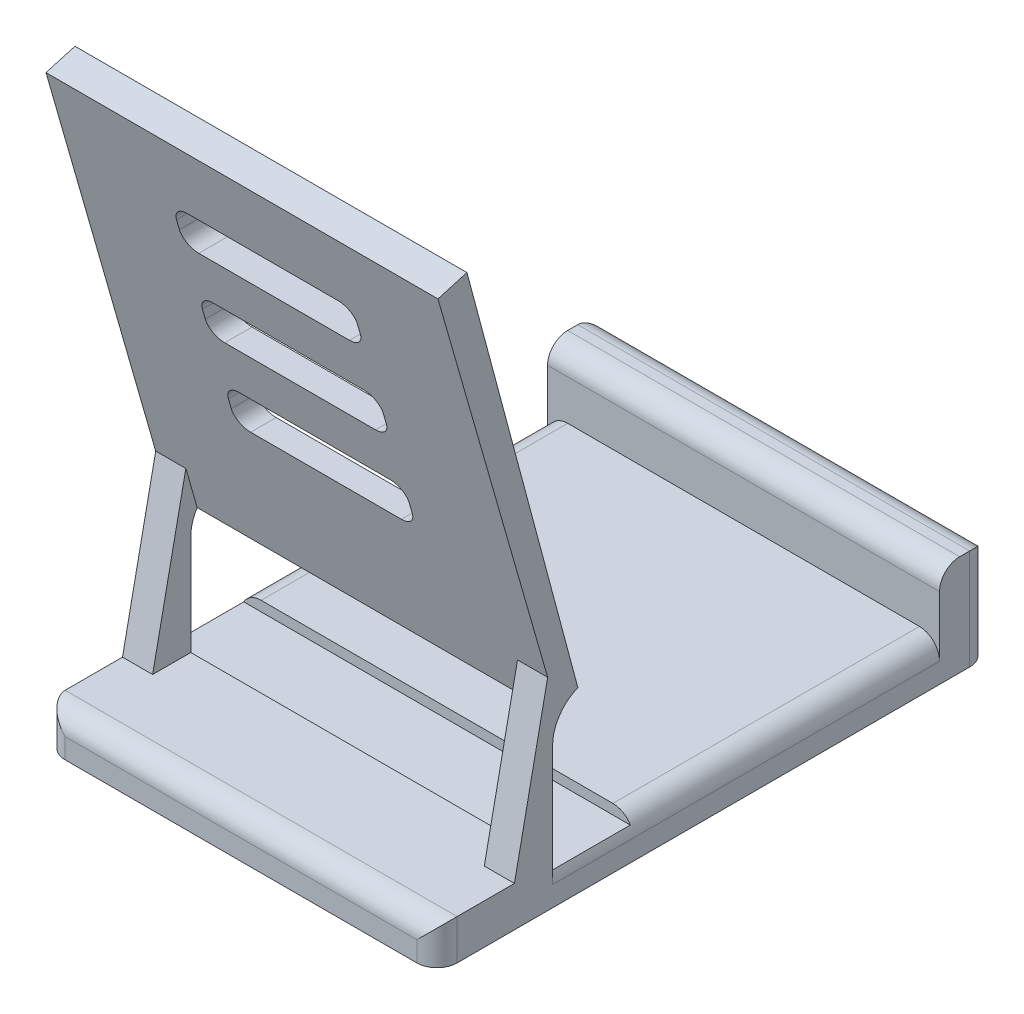
from build123d import *

# Parameters (mm, degrees)
EXTRUDE_1_DEPTH     = 78
EXTRUDE_2_DEPTH     = 78
EXTRUDE_4_DEPTH     = 6
CUT_EXTRUDE_3_DEPTH = 80
CUT_EXTRUDE_4_DEPTH = 160.514889587
CUT_EXTRUDE_5_DEPTH = 170.32217811
SKETCH_10_W         = 24
SKETCH_10_H         = 10
CUT_EXTRUDE_6_DEPTH = 1.5
FILLET_1_R          = 4
FILLET_START        = -45
FILLET_6_DEPTH      = 77
FILLET_START_2      = -39
FILLET_6_2_DEPTH    = 78


with BuildPart() as part:
    # 草图1 → 凸台-拉伸1 (new body)
    with BuildSketch(Plane(origin=(-39, 0, 0), x_dir=(0, 0, -1), z_dir=(1, 0, 0))):
        Polygon((55, 0), (-55, 0), (-55, 8), (45, 8), (45, 20), (55, 20), align=None)
    extrude(amount=EXTRUDE_1_DEPTH)

    # 草图2 → 凸台-拉伸2 (add)
    with BuildSketch(Plane(origin=(-39, 0, 0), x_dir=(0, 0, -1), z_dir=(1, 0, 0))):
        Polygon((-17.5, 0), (-49.042, 118), (-54.81, 116.346), (-21.45, 0), align=None)
    extrude(amount=EXTRUDE_2_DEPTH)

    # 草图4 → 凸台-拉伸4 (add)
    with BuildSketch(Plane(origin=(33, 0, 0), x_dir=(0, 0, -1), z_dir=(1, 0, 0))):
        Polygon((-20, 6), (-40, 6), (-32, 45), align=None)
    extrude_4 = extrude(amount=EXTRUDE_4_DEPTH)

    # 镜向1: 凸台-拉伸4 across plane
    add(extrude_4.mirror(Plane(origin=(0, 0, 0), x_dir=(0, 0, 1), z_dir=(1, 0, 0))))

    # 草图7 → 切除-拉伸3 (cut)
    with BuildSketch(Plane(origin=(-40, 0, 0), x_dir=(0, 0, -1), z_dir=(1, 0, 0))):
        with BuildLine():
            Line((-16, 6), (-16, 28))
            ThreePointArc((-16, 28), (-24, 36), (-32, 28))
            Line((-32, 28), (-32, 6))
            Line((-32, 6), (-16, 6))
        make_face()
    extrude(amount=CUT_EXTRUDE_3_DEPTH, mode=Mode.SUBTRACT)

    # 草图8 → 切除-拉伸4 (cut, through all)
    with BuildSketch(Plane.XY.offset(45)):
        with BuildLine():
            Line((-15, 58), (15, 58))
            ThreePointArc((15, 58), (17.121320344, 58.878679656), (18, 61))
            Line((18, 61), (18, 63))
            ThreePointArc((18, 63), (17.121320344, 65.121320344), (15, 66))
            Line((15, 66), (-15, 66))
            ThreePointArc((-15, 66), (-17.121320344, 65.121320344), (-18, 63))
            Line((-18, 63), (-18, 61))
            ThreePointArc((-18, 61), (-17.121320344, 58.878679656), (-15, 58))
        make_face()
        with BuildLine():
            Line((-15, 76), (15, 76))
            ThreePointArc((15, 76), (17.121320344, 76.878679656), (18, 79))
            Line((18, 79), (18, 81))
            ThreePointArc((18, 81), (17.121320344, 83.121320344), (15, 84))
            Line((15, 84), (-15, 84))
            ThreePointArc((-15, 84), (-17.121320344, 83.121320344), (-18, 81))
            Line((-18, 81), (-18, 79))
            ThreePointArc((-18, 79), (-17.121320344, 76.878679656), (-15, 76))
        make_face()
        with BuildLine():
            Line((-15, 94), (15, 94))
            ThreePointArc((15, 94), (17.121320344, 94.878679656), (18, 97))
            Line((18, 97), (18, 99))
            ThreePointArc((18, 99), (17.121320344, 101.121320344), (15, 102))
            Line((15, 102), (-15, 102))
            ThreePointArc((-15, 102), (-17.121320344, 101.121320344), (-18, 99))
            Line((-18, 99), (-18, 97))
            ThreePointArc((-18, 97), (-17.121320344, 94.878679656), (-15, 94))
        make_face()
    extrude(amount=-CUT_EXTRUDE_4_DEPTH, mode=Mode.SUBTRACT)

    # 草图9 → 切除-拉伸5 (cut, through all)
    with BuildSketch(Plane.XY.offset(60)):
        with BuildLine():
            Line((-15, 58), (15, 58))
            ThreePointArc((15, 58), (17.121320344, 58.878679656), (18, 61))
            Line((18, 61), (18, 63))
            ThreePointArc((18, 63), (17.121320344, 65.121320344), (15, 66))
            Line((15, 66), (-15, 66))
            ThreePointArc((-15, 66), (-17.121320344, 65.121320344), (-18, 63))
            Line((-18, 63), (-18, 61))
            ThreePointArc((-18, 61), (-17.121320344, 58.878679656), (-15, 58))
        make_face()
        with BuildLine():
            Line((-15, 76), (15, 76))
            ThreePointArc((15, 76), (17.121320344, 76.878679656), (18, 79))
            Line((18, 79), (18, 81))
            ThreePointArc((18, 81), (17.121320344, 83.121320344), (15, 84))
            Line((15, 84), (-15, 84))
            ThreePointArc((-15, 84), (-17.121320344, 83.121320344), (-18, 81))
            Line((-18, 81), (-18, 79))
            ThreePointArc((-18, 79), (-17.121320344, 76.878679656), (-15, 76))
        make_face()
        with BuildLine():
            Line((-15, 94), (15, 94))
            ThreePointArc((15, 94), (17.121320344, 94.878679656), (18, 97))
            Line((18, 97), (18, 99))
            ThreePointArc((18, 99), (17.121320344, 101.121320344), (15, 102))
            Line((15, 102), (-15, 102))
            ThreePointArc((-15, 102), (-17.121320344, 101.121320344), (-18, 99))
            Line((-18, 99), (-18, 97))
            ThreePointArc((-18, 97), (-17.121320344, 94.878679656), (-15, 94))
        make_face()
    extrude(amount=-CUT_EXTRUDE_5_DEPTH, mode=Mode.SUBTRACT)

    # 草图10 → 切除-拉伸6 (cut)
    with BuildSketch(Plane(origin=(0, 0, 0), x_dir=(1, 0, 0), z_dir=(0, 1, 0))):
        with Locations((0, 45)):
            Rectangle(SKETCH_10_W, SKETCH_10_H)
        with Locations((0, -45)):
            Rectangle(SKETCH_10_W, SKETCH_10_H)
    extrude(amount=CUT_EXTRUDE_6_DEPTH, mode=Mode.SUBTRACT)

    # 圆角1
    fillet_1_edges = [part.edges().sort_by_distance(p)[0] for p in [
        (0, 20, -45),
        (0, 20, -55),
        (39, 4, 55),
        (39, 10, -55),
        (-39, 4, 55),
        (-39, 10, -55),
    ]]
    fillet(fillet_1_edges, radius=FILLET_1_R)

    # 圆角6: read off the stored shape, not the designer's step
    # 圆角6 outline → 圆角6 (cut)
    with BuildSketch(Plane.XY.offset(FILLET_START)):
        with BuildLine():
            Line((-39, 8), (-39, 4))
            ThreePointArc((-39, 4), (-37.828427125, 6.828427125), (-35, 8))
            Line((-35, 8), (-39, 8))
        make_face()
        with BuildLine():
            Line((39, 8), (35, 8))
            ThreePointArc((35, 8), (37.828427125, 6.828427125), (39, 4))
            Line((39, 4), (39, 8))
        make_face()
    extrude(amount=FILLET_6_DEPTH, mode=Mode.SUBTRACT)

    # Fillet 6 2 outline → Fillet 6 2 (cut)
    with BuildSketch(Plane.YZ.offset(FILLET_START_2)):
        with BuildLine():
            Line((8, 55), (4, 55))
            ThreePointArc((4, 55), (6.828427125, 53.828427125), (8, 51))
            Line((8, 51), (8, 55))
        make_face()
    extrude(amount=FILLET_6_2_DEPTH, mode=Mode.SUBTRACT)


solid = part.part
